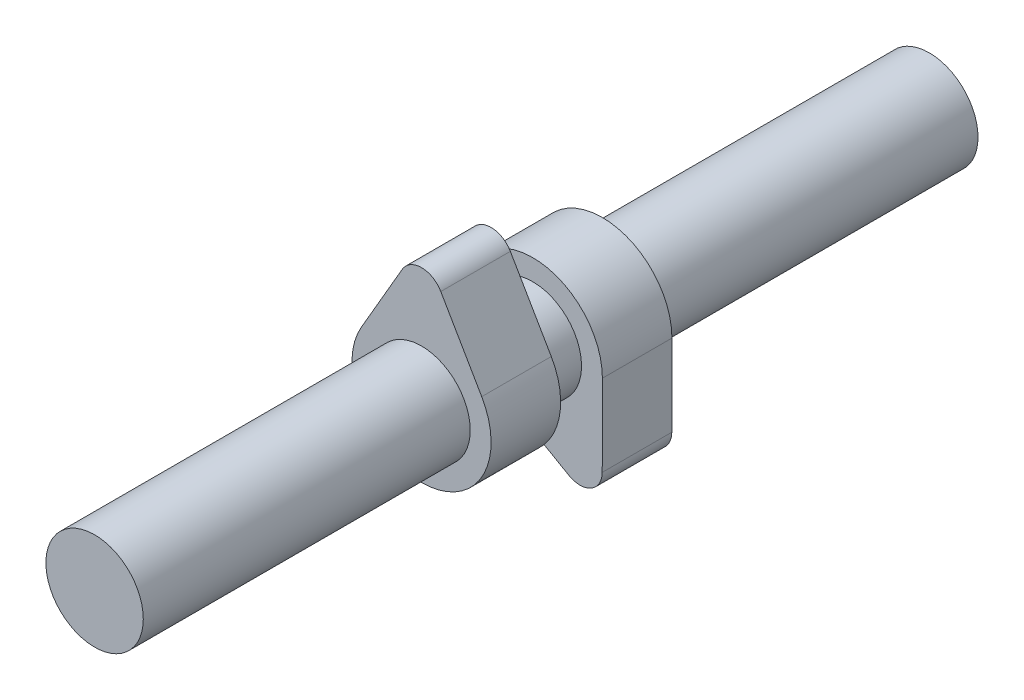
from build123d import *

# Parameters (mm, degrees)
SKETCH2_R           = 17.5
BOSS_EXTRUDE1_DEPTH = 150
BOSS_EXTRUDE2_START = -130
SKETCH3_R           = 17.5
BOSS_EXTRUDE2_DEPTH = 12.5
BOSS_EXTRUDE3_START = -170
BOSS_EXTRUDE3_DEPTH = 12.5


with BuildPart() as part:
    # Sketch2 → Boss-Extrude1 (new, symmetric)
    with BuildSketch(Plane.XY):
        Circle(SKETCH2_R)
    extrude(amount=BOSS_EXTRUDE1_DEPTH, both=True)

    # Sketch3 → Boss-Extrude2 (add, symmetric)
    with BuildSketch(Plane.XY.offset(150).offset(BOSS_EXTRUDE2_START)):
        with BuildLine():
            Line((-6.921377427, 37.91179941), (-21.629304461, 12.536873156))
            ThreePointArc((-21.629304461, 12.536873156), (0, -25), (21.629304461, 12.536873156))
            Line((21.629304461, 12.536873156), (6.921377427, 37.91179941))
            ThreePointArc((6.921377427, 37.91179941), (0, 41.9), (-6.921377427, 37.91179941))
        make_face()
        Circle(SKETCH3_R, mode=Mode.SUBTRACT)
    extrude(amount=BOSS_EXTRUDE2_DEPTH, both=True)

    # Sketch4 → Boss-Extrude3 (add, symmetric)
    with BuildSketch(Plane.XY.offset(150).offset(BOSS_EXTRUDE3_START)):
        with BuildLine():
            Line((24.999963707, -0.042598407), (24.949988386, -29.371892679))
            ThreePointArc((24.949988386, -29.371892679), (20.95, -36.286464419), (12.961811024, -36.293270106))
            Line((12.961811024, -36.293270106), (-12.463090551, -21.671902868))
            ThreePointArc((-12.463090551, -21.671902868), (-12.5, 21.650635095), (24.999963707, -0.042598407))
        make_face()
    extrude(amount=BOSS_EXTRUDE3_DEPTH, both=True)


solid = part.part
